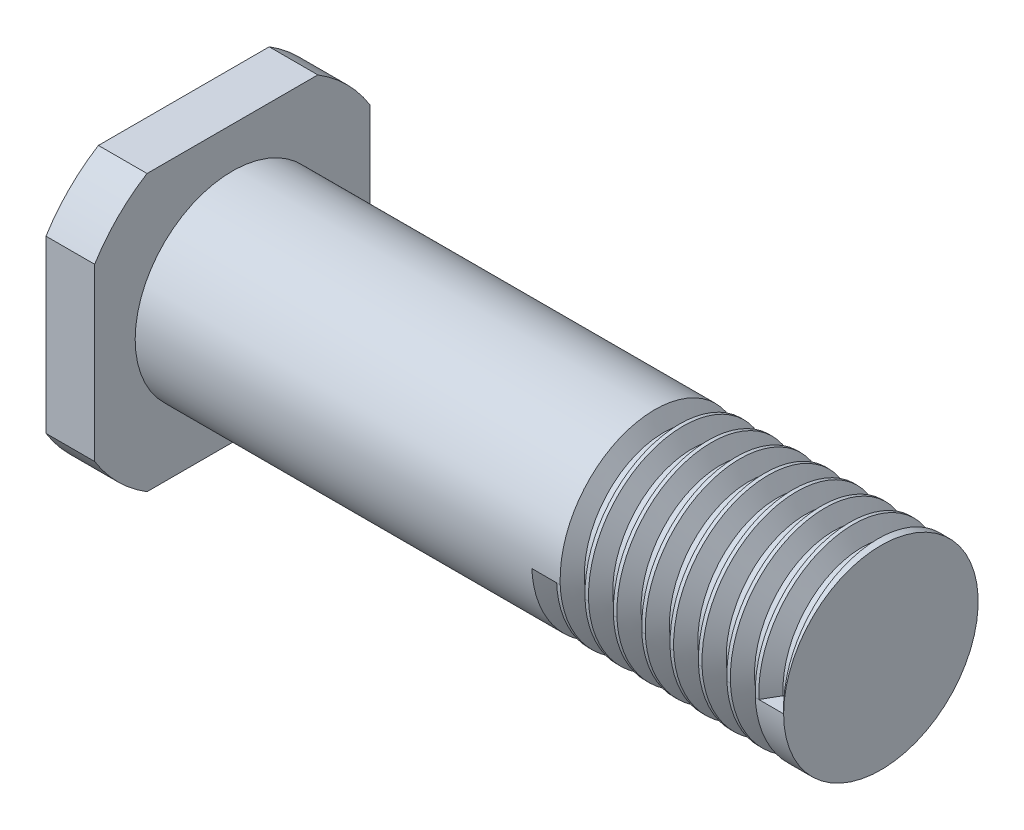
from build123d import *

# Parameters (mm, degrees)
SKETCH_2_OUTSIDE_W   = 32.294
SKETCH_2_OUTSIDE_H   = 32.294
SKETCH_2_OUTSIDE_W_2 = 17
SKETCH_2_OUTSIDE_H_2 = 17
CUT_EXTRUDE_1_DEPTH  = 46.265881191
THREAD_1_PITCH       = 1.75


with BuildPart() as part:
    # Sketch 1 → 旋转1 (revolve)
    with BuildSketch(Plane.XY, mode=Mode.PRIVATE) as revolve_1_sk:
        Polygon((0, 0), (0, 10), (3, 10), (3, 6), (43, 6), (43, 0), align=None)
    revolve(revolve_1_sk.sketch.rotate(Axis((-4.272727273, 0, 0), (1, 0, 0)), 90), axis=Axis((-4.272727273, 0, 0), (1, 0, 0)))

    # 草图2 outside → 切除-拉伸1 (cut, through all)
    with BuildSketch(Plane.ZY):
        Rectangle(SKETCH_2_OUTSIDE_W, SKETCH_2_OUTSIDE_H)
        Rectangle(SKETCH_2_OUTSIDE_W_2, SKETCH_2_OUTSIDE_H_2, mode=Mode.SUBTRACT)
    extrude(amount=-CUT_EXTRUDE_1_DEPTH, mode=Mode.SUBTRACT)

    # 螺纹线1: the profile of Sketch 1 2 profile screwed along a right-hand helix of 8 turns, 10 arcs to a turn; built about Z, then put on its axis
    thread_1_z = Axis((0, 0, 0), (0, 0, 1))
    thread_1_corners = [(6.0003, 0, -0.000173205), (6.0003, 0, 1.5314232), (5.052784719, 0, 0.984374998), (5.052784719, 0, 0.546874998)]
    with BuildLine(mode=Mode.PRIVATE) as thread_1_profile:
        Line(thread_1_corners[0], thread_1_corners[1])
        Line(thread_1_corners[1], thread_1_corners[2])
        Line(thread_1_corners[2], thread_1_corners[3])
        Line(thread_1_corners[3], thread_1_corners[0])
    thread_1_cap = Face(thread_1_profile.wire())
    thread_1_turn_angles = [0, 18, 36, 54, 72, 90, 108, 126, 144, 162, 180, 198, 216, 234, 252, 270, 288, 306, 324, 342, 360]
    thread_1_turn_weights = [1, 0.9510565162951535, 1, 0.9510565162951535, 1, 0.9510565162951535, 1, 0.9510565162951535, 1, 0.9510565162951535, 1, 0.9510565162951535, 1, 0.9510565162951535, 1, 0.9510565162951535, 1, 0.9510565162951535, 1, 0.9510565162951535, 1]
    thread_1_turn_rails = [Edge.make_bspline([Vector(p[0], p[1], 0).rotate(thread_1_z, thread_1_turn_angles[k]) / thread_1_turn_weights[k] + Vector(0, 0, p[2] + THREAD_1_PITCH * thread_1_turn_angles[k] / 360) for k in range(21)], [0, 0, 0, 1, 1, 2, 2, 3, 3, 4, 4, 5, 5, 6, 6, 7, 7, 8, 8, 9, 9, 10, 10, 10], 2, thread_1_turn_weights) for p in thread_1_corners]
    thread_1_turn_sides = [Face.make_surface_from_curves(thread_1_turn_rails[p[0]], thread_1_turn_rails[p[1]]) for p in [(0, 1), (1, 2), (2, 3), (3, 0)]]
    thread_1 = Plane(origin=(43, 0, 0), x_dir=(0, 0, 1), z_dir=(-1, 0, 0)) * Solid(Shell([*[p.moved(Location((0, 0, THREAD_1_PITCH * i))) for i in range(8) for p in thread_1_turn_sides], thread_1_cap, thread_1_cap.rotate(thread_1_z, 2880).moved(Location((0, 0, THREAD_1_PITCH * 2880 / 360)))]))
    add(thread_1, mode=Mode.SUBTRACT)


solid = part.part
